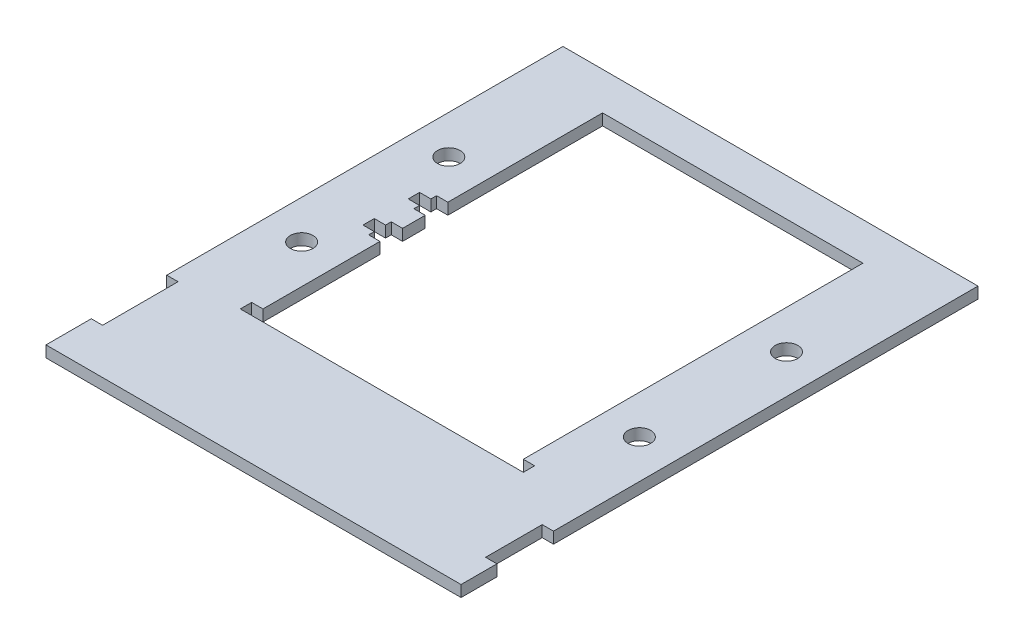
from build123d import *

# Parameters (mm, degrees)
CROQUIS1_R              = 3
SALIENTE_EXTRUIR1_DEPTH = 3


with BuildPart() as part:
    # Croquis1 → Saliente-Extruir1 (new body)
    with BuildSketch(Plane(origin=(0, 0, 0), x_dir=(1, 0, 0), z_dir=(0, 1, 0))):
        Polygon((0, 3), (110, 3), (110, 12.5), (107, 12.5), (107, 20), (107, 27.5), (110, 27.5), (110, 37), (110, 140), (89.5, 140), (20.5, 140), (0, 140), (0, 50), (0, 35), (3, 35), (3, 20), (3, 15), (0, 15), align=None)
        with Locations((10.25, 60.5)):
            Circle(CROQUIS1_R, mode=Mode.SUBTRACT)
        with Locations((99.75, 60.5)):
            Circle(CROQUIS1_R, mode=Mode.SUBTRACT)
        with Locations((10.25, 99.5)):
            Circle(CROQUIS1_R, mode=Mode.SUBTRACT)
        Polygon((92.5, 37), (89.5, 37), (20.5, 37), (17.5, 37), (17.5, 40), (20.5, 40), (20.5, 71), (17.5, 71), (17.5, 72.5), (14.5, 72.5), (14.5, 75.5), (17.5, 75.5), (17.5, 77), (20.5, 77), (20.5, 83), (17.5, 83), (17.5, 84.5), (14.5, 84.5), (14.5, 87.5), (17.5, 87.5), (17.5, 89), (20.5, 89), (20.5, 130), (89.5, 130), (89.5, 89), (89.5, 71), (89.5, 40), (92.5, 40), align=None, mode=Mode.SUBTRACT)
        with Locations((99.75, 99.5)):
            Circle(CROQUIS1_R, mode=Mode.SUBTRACT)
    extrude(amount=SALIENTE_EXTRUIR1_DEPTH)


solid = part.part
